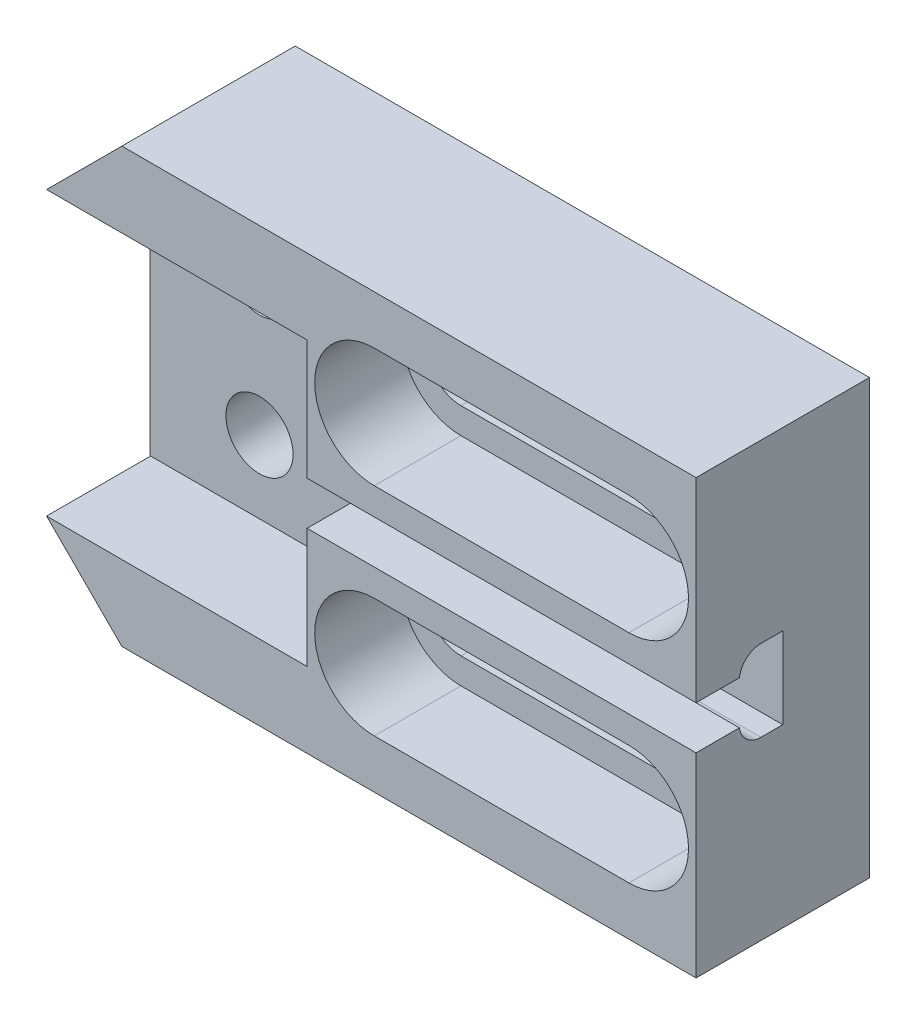
from build123d import *

# Parameters (mm, degrees)
PROFILESKETCH3_W                           = 30
PROFILESKETCH3_H                           = 20
PROFILEBOSS_EXTRUDE1_DEPTH                 = 8
MICROSWITCHCUTSKETCH4_W                    = 12.05
MICROSWITCHCUTSKETCH4_H                    = 13.05
MICROSWITCHCUT_EXTRUDE1_DEPTH              = 4.8
SKETCH5_R                                  = 1.55
MICROSWITCHMOUNTINGHOLESCUT_EXTRUDE2_DEPTH = 3.1
SMALLCHANNELCABLESKETCH6_W                 = 17.95
SMALLCHANNELCABLESKETCH6_H                 = 2
SMALLCHANNELCABLECUT_EXTRUDE3_DEPTH        = 2
LARGECHANNELCABLESKETCH7_W                 = 17.95
LARGECHANNELCABLESKETCH7_H                 = 3.75
LARGECHANNELCABLECUT_EXTRUDE4_DEPTH        = 2
CHAMFER1_SIZE                              = 1
MOUNTSLOTBORECUT_EXTRUDE1_DEPTH            = 4
CHAMFER2_SIZE                              = 3.5
FILLET3_R                                  = 1


with BuildPart() as part:
    # ProfileSketch3 → ProfileBoss-Extrude1 (new body)
    with BuildSketch(Plane.XY):
        with Locations((15, 10)):
            Rectangle(PROFILESKETCH3_W, PROFILESKETCH3_H)
        with BuildLine():
            Line((15.15, 16.55), (26.9, 16.55))
            ThreePointArc((26.9, 16.55), (28.45, 15), (26.9, 13.45))
            Line((26.9, 13.45), (15.15, 13.45))
            ThreePointArc((15.15, 13.45), (13.6, 15), (15.15, 16.55))
        make_face(mode=Mode.SUBTRACT)
        with BuildLine():
            Line((15.15, 6.55), (26.9, 6.55))
            ThreePointArc((26.9, 6.55), (28.45, 5), (26.9, 3.45))
            Line((26.9, 3.45), (15.15, 3.45))
            ThreePointArc((15.15, 3.45), (13.6, 5), (15.15, 6.55))
        make_face(mode=Mode.SUBTRACT)
    extrude(amount=PROFILEBOSS_EXTRUDE1_DEPTH)

    # MicroSwitchCutSketch4 → MicroSwitchCut-Extrude1 (cut)
    with BuildSketch(Plane.XY.offset(8)):
        with Locations((6.025, 10)):
            Rectangle(MICROSWITCHCUTSKETCH4_W, MICROSWITCHCUTSKETCH4_H)
    extrude(amount=-MICROSWITCHCUT_EXTRUDE1_DEPTH, mode=Mode.SUBTRACT)

    # Sketch5 → MicroSwitchMountingHolesCut-Extrude2 (cut)
    with BuildSketch(Plane.XY.offset(3.2)):
        with Locations((5.05, 13.175)):
            Circle(SKETCH5_R)
        with Locations((5.05, 6.825)):
            Circle(SKETCH5_R)
    extrude(amount=-MICROSWITCHMOUNTINGHOLESCUT_EXTRUDE2_DEPTH, mode=Mode.SUBTRACT)

    # SmallChannelCableSketch6 → SmallChannelCableCut-Extrude3 (cut)
    with BuildSketch(Plane.XY.offset(8)):
        with Locations((21.025, 10)):
            Rectangle(SMALLCHANNELCABLESKETCH6_W, SMALLCHANNELCABLESKETCH6_H)
    extrude(amount=-SMALLCHANNELCABLECUT_EXTRUDE3_DEPTH, mode=Mode.SUBTRACT)

    # LargeChannelCableSketch7 → LargeChannelCableCut-Extrude4 (cut)
    with BuildSketch(Plane.XY.offset(6)):
        with Locations((21.025, 10)):
            Rectangle(LARGECHANNELCABLESKETCH7_W, LARGECHANNELCABLESKETCH7_H)
    extrude(amount=-LARGECHANNELCABLECUT_EXTRUDE4_DEPTH, mode=Mode.SUBTRACT)

    # Chamfer1
    # the kernel refuses this chamfer: 1 mm, written as the material it takes off along each edge
    with BuildSketch(Plane(origin=(12.05, 8.125, 4), x_dir=(0.9996219169112968, 0, 0.02749587661058651), z_dir=(0, 1, 0))) as chamfer1_piece_1_section:
        Polygon((CHAMFER1_SIZE * 0.999621916911, CHAMFER1_SIZE * 0.0274958766106), (-CHAMFER1_SIZE * 0.0274958766106, CHAMFER1_SIZE * 0.999621916911), (0, 0), align=None)
    chamfer1_piece_1 = extrude(amount=3.75, mode=Mode.PRIVATE)
    chamfer1_piece_1 = split(chamfer1_piece_1, bisect_by=Plane(origin=(12.395718412, 10, 3.2), z_dir=(0, 0, 1)), keep=Keep.TOP, mode=Mode.PRIVATE)
    add(chamfer1_piece_1, mode=Mode.SUBTRACT)

    # Sketch6 → MountSLotBoreCut-Extrude1 (cut)
    with BuildSketch(Plane.XY.offset(8)):
        with BuildLine():
            Line((15.15, 17.75), (26.9, 17.75))
            ThreePointArc((26.9, 17.75), (29.65, 15), (26.9, 12.25))
            Line((26.9, 12.25), (15.15, 12.25))
            ThreePointArc((15.15, 12.25), (12.4, 15), (15.15, 17.75))
        make_face()
        with BuildLine():
            Line((15.15, 7.75), (26.9, 7.75))
            ThreePointArc((26.9, 7.75), (29.65, 5), (26.9, 2.25))
            Line((26.9, 2.25), (15.15, 2.25))
            ThreePointArc((15.15, 2.25), (12.4, 5), (15.15, 7.75))
        make_face()
    extrude(amount=-MOUNTSLOTBORECUT_EXTRUDE1_DEPTH, mode=Mode.SUBTRACT)

    # Chamfer2
    chamfer2_edges = [part.edges().sort_by_distance(p)[0] for p in [
        (0, 20, 4),
        (0, 0, 4),
    ]]
    chamfer(chamfer2_edges, length=CHAMFER2_SIZE)

    # Fillet3
    # the kernel refuses this fillet: 1 mm, written as the material it adds along each edge
    with BuildSketch(Plane(origin=(12.05, 11.875, 6), x_dir=(0, 0, -1), z_dir=(1, 0, 0))) as fillet3_piece_1:
        with BuildLine():
            CenterArc((0.992156742, -1), FILLET3_R, 90, 82.819244219)
            Line((0, -0.875), (-0.019843135, -0.8725))
            ThreePointArc((-0.019843135, -0.8725), (-0.02, -0.4375), (-0.02, 0))
            Line((-0.02, 0), (0, 0.02))
            Line((0, 0.02), (0.992156742, 0.02))
            Line((0.992156742, 0.02), (0.992156742, 0))
        make_face()
    extrude(amount=17.95)
    with BuildSketch(Plane(origin=(30, 8.125, 6), x_dir=(0, 1, 0), z_dir=(-1, 0, 0))) as fillet3_piece_2:
        with BuildLine():
            CenterArc((1, 0.992156742), FILLET3_R, 180, 82.819244219)
            Line((0, 0.992156742), (-0.02, 0.992156742))
            Line((-0.02, 0.992156742), (-0.02, 0))
            Line((-0.02, 0), (0, -0.02))
            ThreePointArc((0, -0.02), (0.4375, -0.02), (0.8725, -0.019843135))
            Line((0.8725, -0.019843135), (0.875, 0))
        make_face()
    extrude(amount=17.95)


solid = part.part
